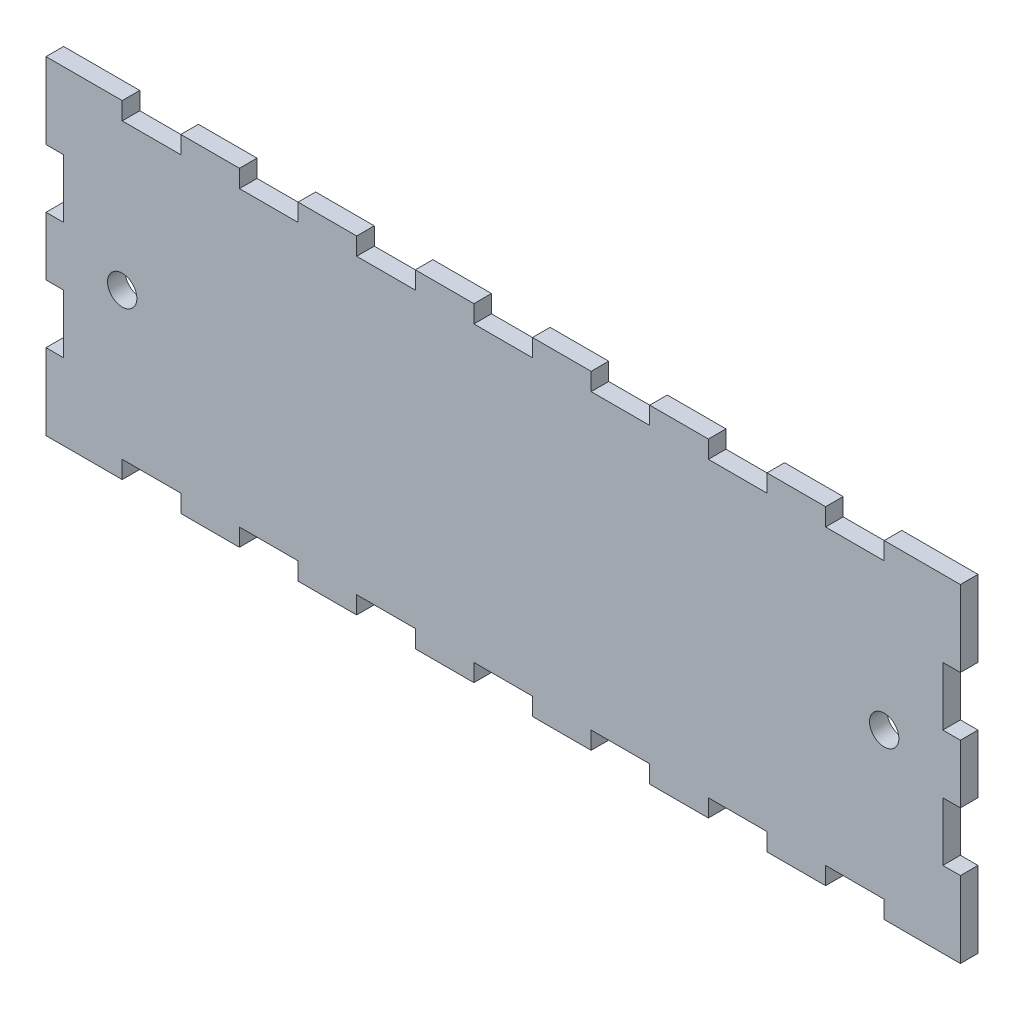
from build123d import *

# Parameters (mm, degrees)
BOSS_EXTRUDE1_DEPTH = 3
SKETCH2_R           = 2.5
CUT_EXTRUDE1_DEPTH  = 3


with BuildPart() as part:
    # Sketch1 → Boss-Extrude1 (new body)
    with BuildSketch(Plane.XY):
        Polygon((15, 28), (15, 25), (25, 25), (25, 28), (35, 28), (35, 25), (45, 25), (45, 28), (55, 28), (55, 25), (65, 25), (65, 28), (78, 28), (78, 15), (75, 15), (75, 5), (78, 5), (78, -5), (75, -5), (75, -15), (78, -15), (78, -28), (65, -28), (65, -25), (55, -25), (55, -28), (45, -28), (45, -25), (35, -25), (35, -28), (25, -28), (25, -25), (15, -25), (15, -28), (5, -28), (5, -25), (-5, -25), (-5, -28), (-15, -28), (-15, -25), (-25, -25), (-25, -28), (-35, -28), (-35, -25), (-45, -25), (-45, -28), (-55, -28), (-55, -25), (-65, -25), (-65, -28), (-78, -28), (-78, -15), (-75, -15), (-75, -5), (-78, -5), (-78, 5), (-75, 5), (-75, 15), (-78, 15), (-78, 28), (-65, 28), (-65, 25), (-55, 25), (-55, 28), (-45, 28), (-45, 25), (-35, 25), (-35, 28), (-25, 28), (-25, 25), (-15, 25), (-15, 28), (-5, 28), (-5, 25), (5, 25), (5, 28), align=None)
    extrude(amount=BOSS_EXTRUDE1_DEPTH)

    # Sketch2 → Cut-Extrude1 (cut)
    with BuildSketch(Plane.XY.offset(3)):
        with Locations((-65, 0)):
            Circle(SKETCH2_R)
        with Locations((65, 0)):
            Circle(SKETCH2_R)
    extrude(amount=-CUT_EXTRUDE1_DEPTH, mode=Mode.SUBTRACT)


solid = part.part
